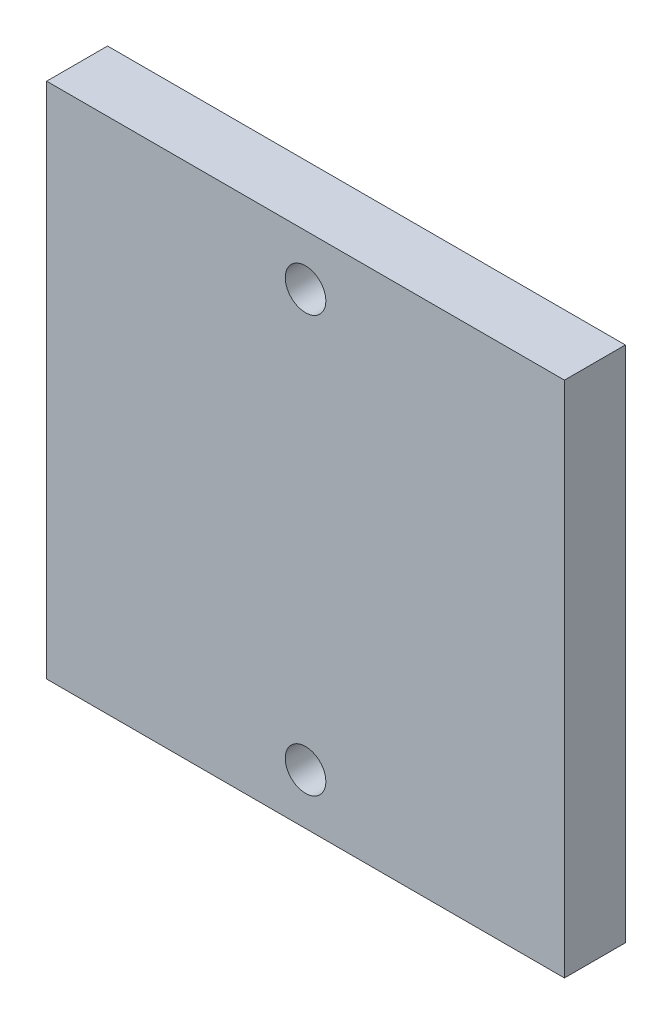
from build123d import *

# Parameters (mm, degrees)
ESBO_O1_W                = 51
ESBO_O1_H                = 51
RESSALTO_EXTRUS_O1_DEPTH = 6
ESBO_O2_W                = 6.5
ESBO_O2_H                = 36.5
CORTE_EXTRUS_O1_DEPTH    = 4.5
ESBO_O3_R                = 2
CORTE_EXTRUS_O2_DEPTH    = 37.558172821


with BuildPart() as part:
    # Esboço1 → Ressalto-extrusão1 (new body)
    with BuildSketch(Plane.XY):
        Rectangle(ESBO_O1_W, ESBO_O1_H)
    extrude(amount=RESSALTO_EXTRUS_O1_DEPTH)

    # Esboço2 → Corte-extrusão1 (cut)
    with BuildSketch(Plane(origin=(0, 0, 0), x_dir=(-1, 0, 0), z_dir=(0, 0, -1))):
        with Locations((-20.85, -5.85)):
            Rectangle(ESBO_O2_W, ESBO_O2_H)
    extrude(amount=-CORTE_EXTRUS_O1_DEPTH, mode=Mode.SUBTRACT)

    # Esboço3 → Corte-extrusão2 (cut, through all)
    with BuildSketch(Plane.XY.offset(6)):
        with Locations((0, -20.5)):
            Circle(ESBO_O3_R)
        with Locations((0, 20.5)):
            Circle(ESBO_O3_R)
    extrude(amount=-CORTE_EXTRUS_O2_DEPTH, mode=Mode.SUBTRACT)


solid = part.part
